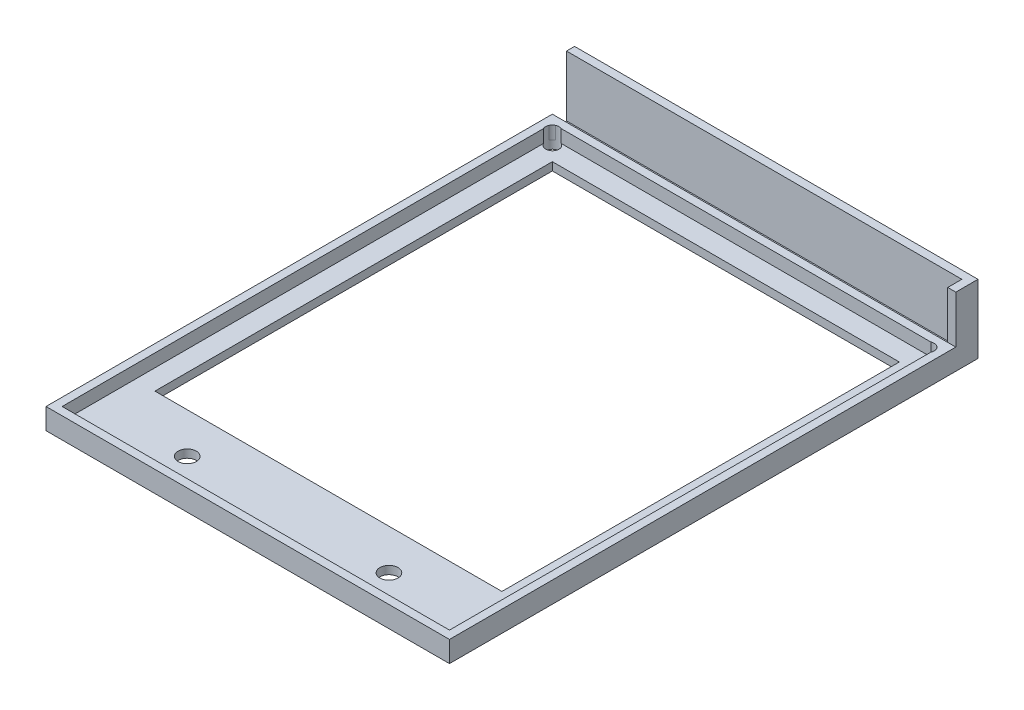
from build123d import *

# Parameters (mm, degrees)
SKETCH1_W                      = 96
SKETCH1_H                      = 121.5
SKETCH1_W_2                    = 86
SKETCH1_H_2                    = 98.5
BOSS_EXTRUDE1_DEPTH            = 2
SKETCH2_W                      = 100
SKETCH2_H                      = 125.5
SKETCH2_W_2                    = 96
SKETCH2_H_2                    = 121.5
BOSS_EXTRUDE2_DEPTH            = 5.2
CUT_EXTRUDE1_REACH             = 82.403
SKETCH3_R                      = 2.25
SKETCH3_R_2                    = 1.65
CUT_EXTRUDE1_DIRECTION_2_DEPTH = 81.402751819
FILLET1_R                      = 1.65
SKETCH4_W                      = 100
SKETCH4_H                      = 5.5
BOSS_EXTRUDE3_DEPTH            = 2
BOSS_EXTRUDE5_DEPTH            = 15


with BuildPart() as part:
    # Sketch1 → Boss-Extrude1 (new body)
    with BuildSketch(Plane(origin=(0, 0, 0), x_dir=(1, 0, 0), z_dir=(0, 1, 0))):
        Rectangle(SKETCH1_W, SKETCH1_H)
        with Locations((0, 6.5)):
            Rectangle(SKETCH1_W_2, SKETCH1_H_2, mode=Mode.SUBTRACT)
    extrude(amount=BOSS_EXTRUDE1_DEPTH)

    # Sketch2 → Boss-Extrude2 (add)
    with BuildSketch(Plane(origin=(0, 0, 0), x_dir=(1, 0, 0), z_dir=(0, 1, 0))):
        Rectangle(SKETCH2_W, SKETCH2_H)
        Rectangle(SKETCH2_W_2, SKETCH2_H_2, mode=Mode.SUBTRACT)
    extrude(amount=BOSS_EXTRUDE2_DEPTH)

    # Sketch3 → Cut-Extrude1 (cut, up to next)
    with BuildSketch(Plane.XZ, mode=Mode.PRIVATE) as cut_extrude1_sk1:
        with Locations(Location((25, 52.75, 0), (0, 0, 90))):
            Circle(SKETCH3_R)
    cut_extrude1_tool1 = extrude(cut_extrude1_sk1.sketch, amount=-CUT_EXTRUDE1_REACH, mode=Mode.PRIVATE) & part.part
    # Sketch3 → Cut-Extrude1 (cut, up to next)
    with BuildSketch(Plane.XZ, mode=Mode.PRIVATE) as cut_extrude1_sk2:
        with Locations(Location((-25, 52.75, 0), (0, 0, 90))):
            Circle(SKETCH3_R)
    cut_extrude1_tool2 = extrude(cut_extrude1_sk2.sketch, amount=-CUT_EXTRUDE1_REACH, mode=Mode.PRIVATE) & part.part
    # Sketch3 → Cut-Extrude1 (cut, up to next)
    with BuildSketch(Plane.XZ, mode=Mode.PRIVATE) as cut_extrude1_sk3:
        with Locations(Location((46.5, -59.25, 0), (0, 0, 24.619977329))):
            Circle(SKETCH3_R_2)
    cut_extrude1_tool3 = extrude(cut_extrude1_sk3.sketch, amount=-CUT_EXTRUDE1_REACH, mode=Mode.PRIVATE) & part.part
    # Sketch3 → Cut-Extrude1 (cut, up to next)
    with BuildSketch(Plane.XZ, mode=Mode.PRIVATE) as cut_extrude1_sk4:
        with Locations(Location((-46.5, -59.25, 0), (0, 0, 155.380022671))):
            Circle(SKETCH3_R_2)
    cut_extrude1_tool4 = extrude(cut_extrude1_sk4.sketch, amount=-CUT_EXTRUDE1_REACH, mode=Mode.PRIVATE) & part.part
    add(cut_extrude1_tool1.solids().sort_by_distance((25, 0, 52.75))[0], mode=Mode.SUBTRACT)
    add(cut_extrude1_tool2.solids().sort_by_distance((-25, 0, 52.75))[0], mode=Mode.SUBTRACT)
    add(cut_extrude1_tool3.solids().sort_by_distance((46.5, 0, -59.25))[0], mode=Mode.SUBTRACT)
    add(cut_extrude1_tool4.solids().sort_by_distance((-46.5, 0, -59.25))[0], mode=Mode.SUBTRACT)

    # Sketch3 → Cut-Extrude1 direction 2 (cut)
    with BuildSketch(Plane.XZ):
        with Locations(Location((25, 52.75, 0), (0, 0, 90))):
            Circle(SKETCH3_R)
        with Locations(Location((-25, 52.75, 0), (0, 0, 90))):
            Circle(SKETCH3_R)
        with Locations(Location((46.5, -59.25, 0), (0, 0, 24.619977329))):
            Circle(SKETCH3_R_2)
        with Locations(Location((-46.5, -59.25, 0), (0, 0, 155.380022671))):
            Circle(SKETCH3_R_2)
    extrude(amount=CUT_EXTRUDE1_DIRECTION_2_DEPTH, mode=Mode.SUBTRACT)

    # Fillet1
    # the kernel refuses this fillet: 1.65 mm, written as the material it adds along each edge
    with BuildSketch(Plane(origin=(48, 2, -60.75), x_dir=(0, 0, 1), z_dir=(0, 1, 0))) as fillet1_piece_1_section:
        with BuildLine():
            CenterArc((FILLET1_R, -FILLET1_R), FILLET1_R, 90, 90)
            Line((0, -FILLET1_R), (0, 0))
            Line((0, 0), (FILLET1_R, 0))
        make_face()
    fillet1_piece_1 = extrude(amount=3.2, mode=Mode.PRIVATE)
    fillet1_piece_1 = fillet1_piece_1 - Plane(origin=(46.5, 3.6, -59.25), x_dir=(0.9090909090884159, 0, 0.4165977904559716), z_dir=(0, -1, 0)) * Cylinder(1.65, 13, mode=Mode.PRIVATE)
    add(fillet1_piece_1)
    with BuildSketch(Plane(origin=(-48, 2, -60.75), x_dir=(1, 0, 0), z_dir=(0, 1, 0))) as fillet1_piece_2_section:
        with BuildLine():
            CenterArc((FILLET1_R, -FILLET1_R), FILLET1_R, 90, 90)
            Line((0, -FILLET1_R), (0, 0))
            Line((0, 0), (FILLET1_R, 0))
        make_face()
    fillet1_piece_2 = extrude(amount=3.2, mode=Mode.PRIVATE)
    fillet1_piece_2 = fillet1_piece_2 - Plane(origin=(-46.5, 3.6, -59.25), x_dir=(-0.9090909090884159, 0, 0.4165977904559715), z_dir=(0, -1, 0)) * Cylinder(1.65, 14, mode=Mode.PRIVATE)
    add(fillet1_piece_2)

    # Sketch4 → Boss-Extrude3 (add)
    with BuildSketch(Plane(origin=(0, 0, 0), x_dir=(1, 0, 0), z_dir=(0, 1, 0))):
        with Locations((0, 65.5)):
            Rectangle(SKETCH4_W, SKETCH4_H)
    extrude(amount=BOSS_EXTRUDE3_DEPTH)

    # Sketch7 → Boss-Extrude5 (add)
    with BuildSketch(Plane(origin=(0, 2, 0), x_dir=(1, 0, 0), z_dir=(0, 1, 0))):
        Polygon((-50, 68.25), (50, 68.25), (50, 62.75), (48, 62.75), (48, 66.25), (-50, 66.25), align=None)
    extrude(amount=BOSS_EXTRUDE5_DEPTH)


solid = part.part
